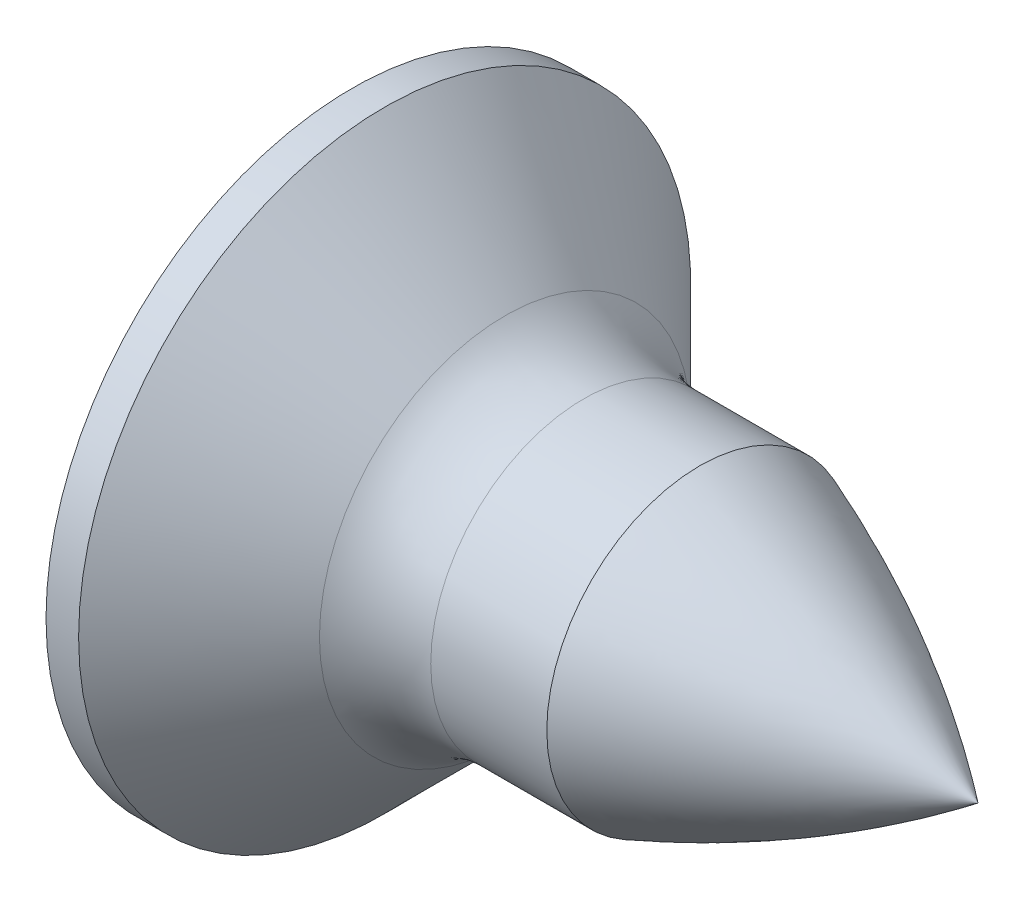
from build123d import *

# Parameters (mm, degrees)
CROSSRECESS_DEPTH = 1.2
DRAFT1_ANGLE      = -30


with BuildPart() as part:
    # Sketch1 → Base (revolve)
    with BuildSketch(Plane.XY):
        with BuildLine():
            Line((5, 0), (5, 1.1))
            Line((5, 1.1), (2.165685425, 1.1))
            ThreePointArc((2.165685425, 1.1), (1.859538679, 1.160896374), (1.6, 1.334314575))
            Line((1.6, 1.334314575), (0.734314575, 2.2))
            Line((0.734314575, 2.2), (0.5, 2.2))
            ThreePointArc((0.5, 2.2), (0.126573764, 1.128051417), (0, 0))
            Line((0, 0), (5, 0))
        make_face()
    revolve(axis=Axis((-20.418228315, 0, 0), (1, 0, 0)))

    # Sketch2 → CrossRecess (cut)
    with BuildSketch(Plane(origin=(0, 0, 0), x_dir=(0, 0, -1), z_dir=(1, 0, 0))):
        Polygon((-0.22, 1.1), (0.22, 1.1), (0.22, 0.22), (1.1, 0.22), (1.1, -0.22), (0.22, -0.22), (0.22, -1.1), (-0.22, -1.1), (-0.22, -0.22), (-1.1, -0.22), (-1.1, 0.22), (-0.22, 0.22), align=None)
    extrude(amount=CROSSRECESS_DEPTH, mode=Mode.SUBTRACT)

    # Sketch5 → Cut-Revolve6 (revolve, cut)
    with BuildSketch(Plane.XY):
        with BuildLine():
            Line((5, 0), (5.5, 0))
            Line((5.5, 0), (5.5, -1.1))
            Line((5.5, -1.1), (5, -1.1))
            Line((5, -1.1), (3, -1.1))
            ThreePointArc((3, -1.1), (4.03943286, -0.621696108), (5, 0))
        make_face()
    revolve(axis=Axis((37.040663239, 0, 0), (-1, 0, 0)), mode=Mode.SUBTRACT)

    # Draft1
    draft1_faces = [part.faces().sort_by_distance(p)[0] for p in [
        (0.660951691, -1.1, 0),
        (0.660951691, 0, -1.1),
        (0.660951691, 0, 1.1),
        (0.660951691, 1.1, 0),
    ]]
    draft(draft1_faces, Plane(origin=(0, 0, 0), x_dir=(0, 0, 1), z_dir=(1, 0, 0)), DRAFT1_ANGLE)


solid = part.part
